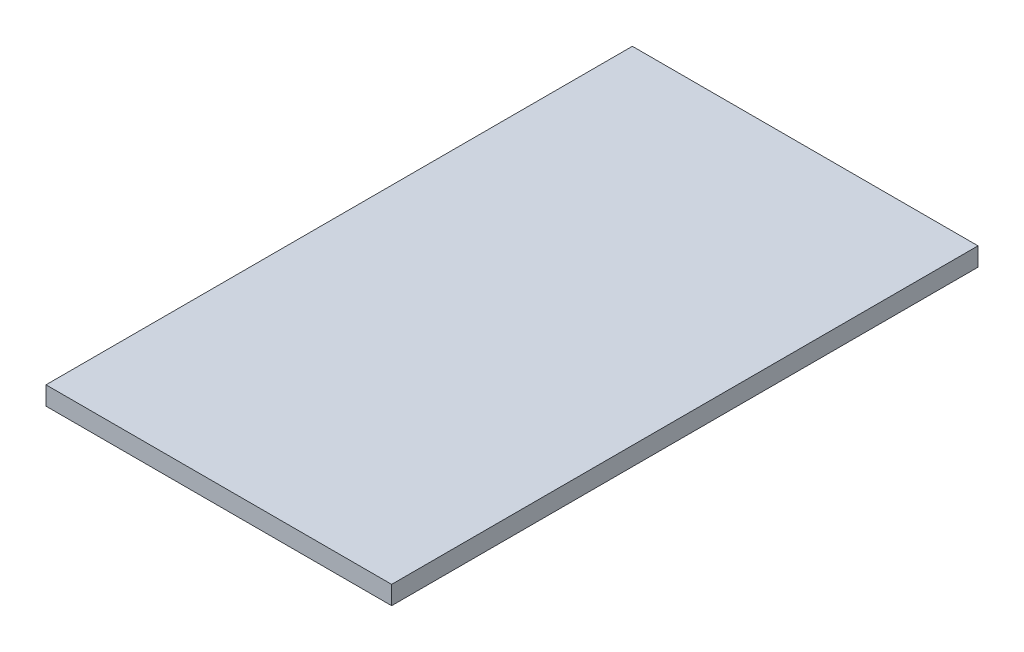
from build123d import *

# Parameters (mm, degrees)
SKETCH1_W           = 168
SKETCH1_H           = 285
BOSS_EXTRUDE1_DEPTH = 9


with BuildPart() as part:
    # Sketch1 → Boss-Extrude1 (new body)
    with BuildSketch(Plane(origin=(0, 0, 0), x_dir=(1, 0, 0), z_dir=(0, 1, 0))):
        Rectangle(SKETCH1_W, SKETCH1_H)
    extrude(amount=BOSS_EXTRUDE1_DEPTH)


solid = part.part
